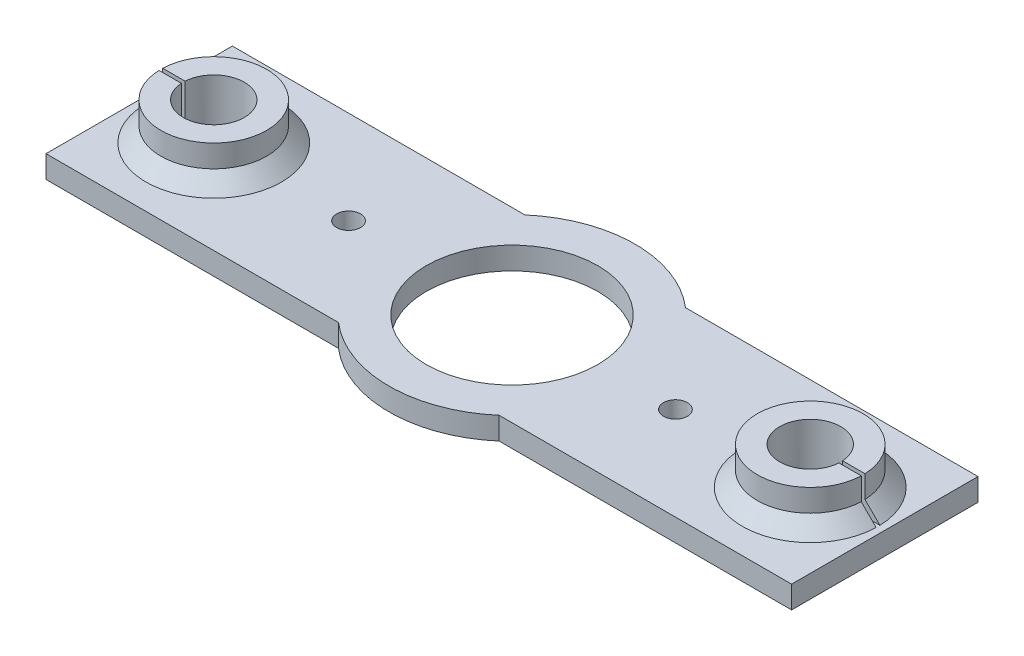
from build123d import *

# Parameters (mm, degrees)
SKETCH1_R           = 1.6
SKETCH1_R_2         = 4.1
SKETCH1_R_3         = 11.5
BOSS_EXTRUDE1_DEPTH = 3
BOSS_EXTRUDE2_DEPTH = 5
CHAMFER1_SIZE       = 2


with BuildPart() as part:
    # Sketch1 → Boss-Extrude1 (new body)
    with BuildSketch(Plane(origin=(0, 0, 0), x_dir=(1, 0, 0), z_dir=(0, 1, 0))):
        with BuildLine():
            Line((10.770329614, -12.5), (50, -12.5))
            Line((50, -12.5), (50, 12.5))
            Line((50, 12.5), (10.770329614, 12.5))
            ThreePointArc((10.770329614, 12.5), (0, 16.5), (-10.770329614, 12.5))
            Line((-10.770329614, 12.5), (-50, 12.5))
            Line((-50, 12.5), (-50, -12.5))
            Line((-50, -12.5), (-10.770329614, -12.5))
            ThreePointArc((-10.770329614, -12.5), (0, -16.5), (10.770329614, -12.5))
        make_face()
        with Locations((21.92, 0)):
            Circle(SKETCH1_R, mode=Mode.SUBTRACT)
        with Locations((40, 0)):
            Circle(SKETCH1_R_2, mode=Mode.SUBTRACT)
        Circle(SKETCH1_R_3, mode=Mode.SUBTRACT)
        with Locations((-21.92, 0)):
            Circle(SKETCH1_R, mode=Mode.SUBTRACT)
        with Locations((-40, 0)):
            Circle(SKETCH1_R_2, mode=Mode.SUBTRACT)
    extrude(amount=BOSS_EXTRUDE1_DEPTH)

    # Sketch2 → Boss-Extrude2 (add)
    with BuildSketch(Plane(origin=(0, 3, 0), x_dir=(1, 0, 0), z_dir=(0, 1, 0))):
        with BuildLine():
            Line((-47.09313577, 0.25), (-44.092370951, 0.25))
            ThreePointArc((-44.092370951, 0.25), (-35.9, 0), (-44.092370951, -0.25))
            Line((-44.092370951, -0.25), (-47.09313577, -0.25))
            ThreePointArc((-47.09313577, -0.25), (-32.902459929, 0), (-47.09313577, 0.25))
        make_face()
        with BuildLine():
            ThreePointArc((44.092370951, -0.25), (35.9, 0), (44.092370951, 0.25))
            Line((44.092370951, 0.25), (47.09313577, 0.25))
            ThreePointArc((47.09313577, 0.25), (32.902459929, 0), (47.09313577, -0.25))
            Line((47.09313577, -0.25), (44.092370951, -0.25))
        make_face()
    extrude(amount=BOSS_EXTRUDE2_DEPTH)

    # Chamfer1
    chamfer1_edges = [part.edges().sort_by_distance(p)[0] for p in [
        (32.902459929, 3, 0),
        (-32.902459929, 3, 0),
    ]]
    chamfer(chamfer1_edges, length=CHAMFER1_SIZE)


solid = part.part
